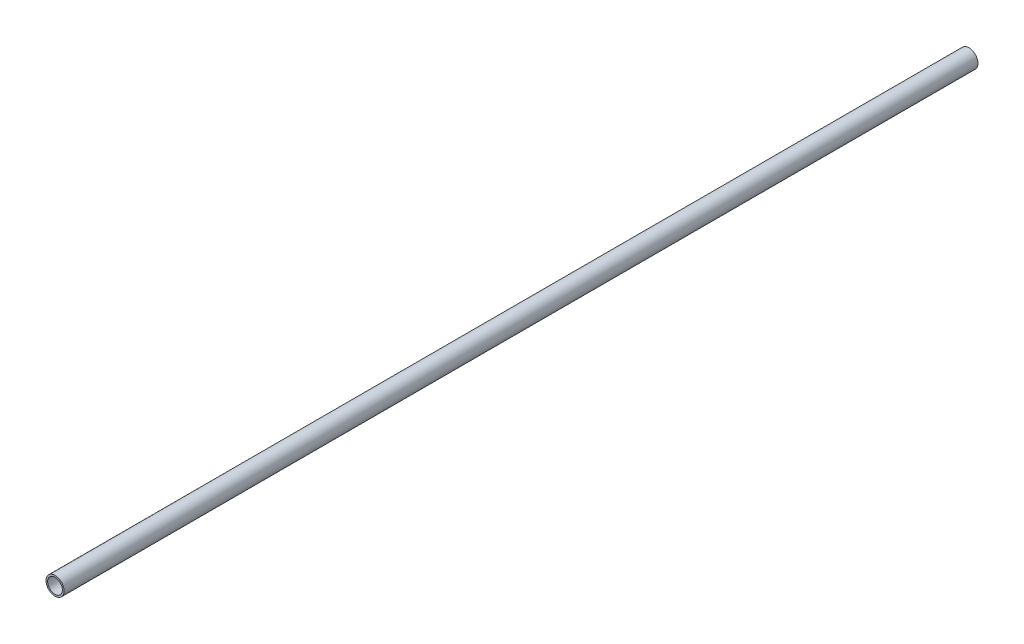
from build123d import *

# Parameters (mm, degrees)
SKETCH1_R           = 30.1625
SKETCH1_R_2         = 24.6253
EXTRUDE_THIN1_DEPTH = 1524


with BuildPart() as part:
    # Sketch1 → Extrude-Thin1 (new, symmetric)
    with BuildSketch(Plane.XY):
        Circle(SKETCH1_R)
        Circle(SKETCH1_R_2, mode=Mode.SUBTRACT)
    extrude(amount=EXTRUDE_THIN1_DEPTH, both=True)


solid = part.part
